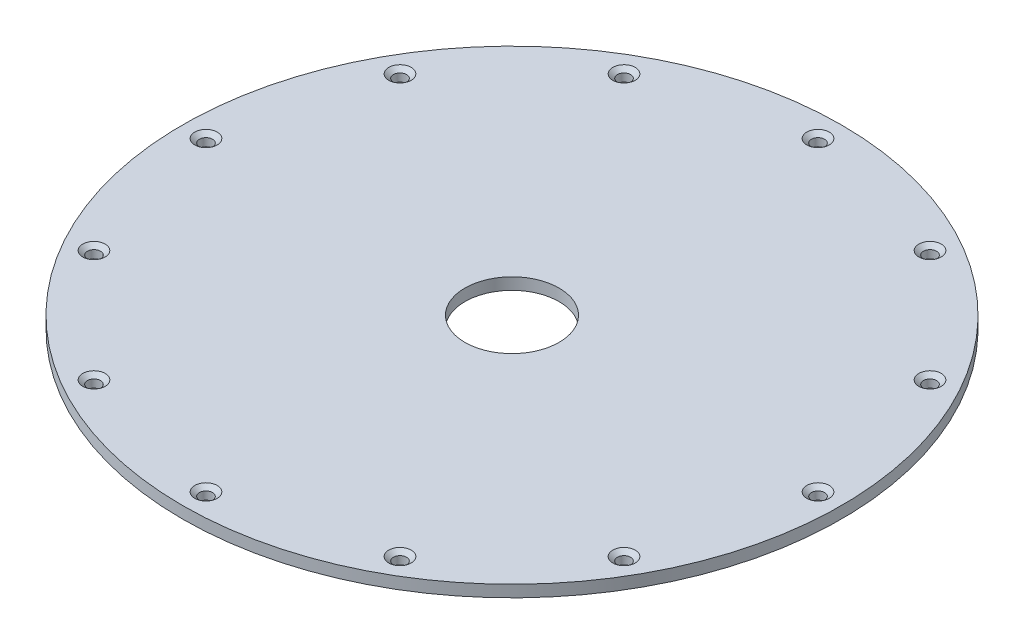
from build123d import *

# Parameters (mm, degrees)
SKETCH1_W                                         = 38.1
SKETCH1_H                                         = 1.5875
CSK_FOR_0_FLAT_HEAD_MACHINE_SCREW_100_D           = 1.778
CSK_FOR_0_FLAT_HEAD_MACHINE_SCREW_100_CSINK_D     = 3.0226
CSK_FOR_0_FLAT_HEAD_MACHINE_SCREW_100_CSINK_ANGLE = 100
CIRPATTERN1_COUNT                                 = 12


with BuildPart() as part:
    # Sketch1 → Revolve1 (revolve)
    with BuildSketch(Plane.XY):
        with Locations((-25.4, 0.79375)):
            Rectangle(SKETCH1_W, SKETCH1_H)
    revolve(axis=Axis((0, 55, 0), (0, -1, 0)))

    # CSK for #0 Flat Head Machine Screw (100)1 (through all)
    with Locations(Plane(origin=(0, 1.5875, 0), x_dir=(1, 0, 0), z_dir=(0, 1, 0))):
        with Locations((-41.275, 0)):
            csk_for_0_flat_head_machine_screw_100 = CounterSinkHole(CSK_FOR_0_FLAT_HEAD_MACHINE_SCREW_100_D / 2, CSK_FOR_0_FLAT_HEAD_MACHINE_SCREW_100_CSINK_D / 2, counter_sink_angle=CSK_FOR_0_FLAT_HEAD_MACHINE_SCREW_100_CSINK_ANGLE)

    # CirPattern1: CSK for #0 Flat Head Machine Screw (100)1 ×12 about axis
    cirpattern1_axis = Axis((0, 55, 0), (0, -1, 0))
    for i in range(1, CIRPATTERN1_COUNT):
        add(csk_for_0_flat_head_machine_screw_100.rotate(cirpattern1_axis, i * 360 / CIRPATTERN1_COUNT), mode=Mode.SUBTRACT)


solid = part.part
